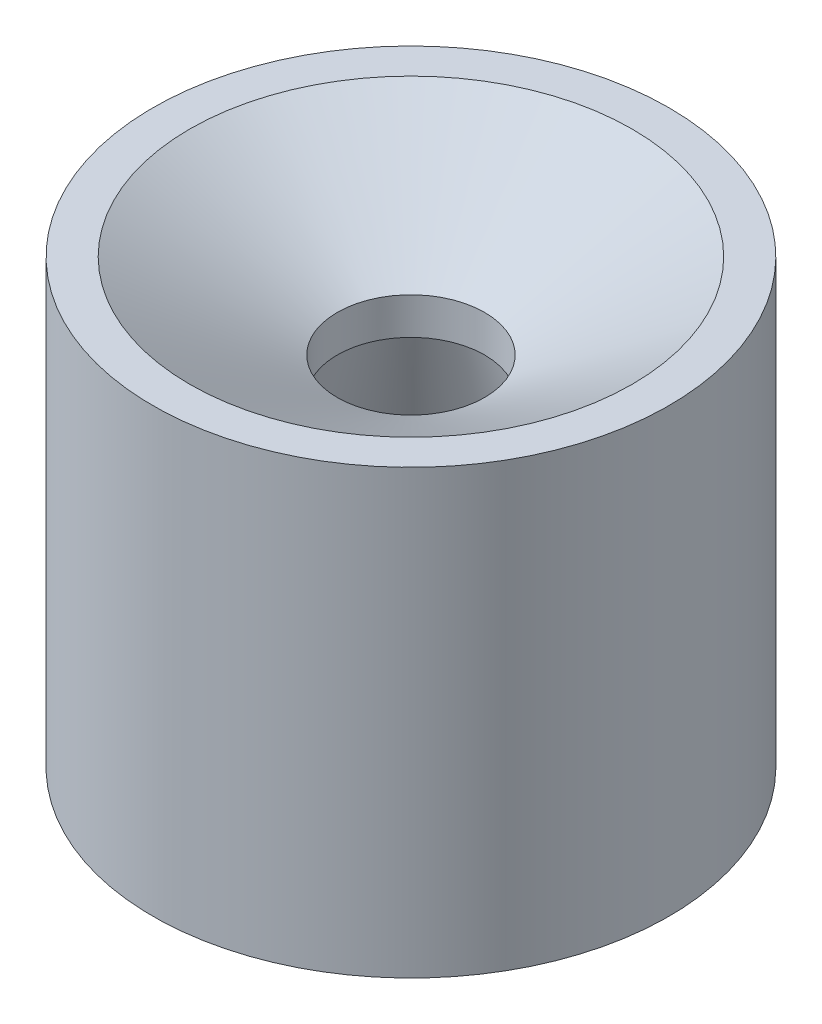
from build123d import *


with BuildPart() as part:
    # Sketch1 → Revolve1 (revolve)
    with BuildSketch(Plane.XY):
        Polygon((-44.45, 0), (-44.45, 76.2), (-38.1, 76.2), (-12.7, 61.535303163), (-12.7, 55.185303163), (-28.321, 0), align=None)
    revolve(axis=Axis((0, 0, 0), (0, 1, 0)))


solid = part.part
